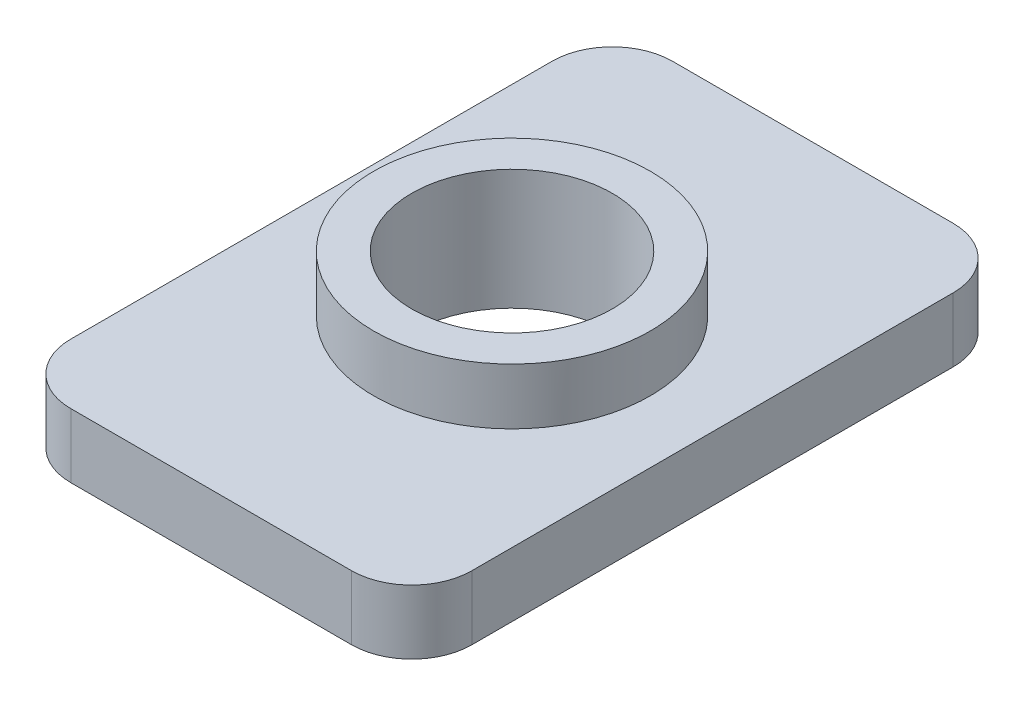
from build123d import *

# Parameters (mm, degrees)
SKETCH_1_W       = 10
SKETCH_1_H       = 15
SKETCH_1_R       = 2.5
BASE_DEPTH       = 1.6
FILLET_2_R       = 1.5
SKETCH_2_R       = 3.45
SKETCH_2_R_2     = 2.5
THREADBODY_DEPTH = 1.4


with BuildPart() as part:
    # Эскиз1 → Base (new body)
    with BuildSketch(Plane(origin=(0, 0, 0), x_dir=(1, 0, 0), z_dir=(0, 1, 0))):
        Rectangle(SKETCH_1_W, SKETCH_1_H)
        Circle(SKETCH_1_R, mode=Mode.SUBTRACT)
    extrude(amount=BASE_DEPTH)

    # Fillet 2
    fillet_2_edges = [part.edges().sort_by_distance(p)[0] for p in [
        (5, 0.8, -7.5),
        (-5, 0.8, -7.5),
        (-5, 0.8, 7.5),
        (5, 0.8, 7.5),
    ]]
    fillet(fillet_2_edges, radius=FILLET_2_R)

    # Эскиз2 → ThreadBody (add)
    with BuildSketch(Plane(origin=(0, 1.6, 0), x_dir=(1, 0, 0), z_dir=(0, 1, 0))):
        Circle(SKETCH_2_R)
        Circle(SKETCH_2_R_2, mode=Mode.SUBTRACT)
    extrude(amount=THREADBODY_DEPTH)


solid = part.part
